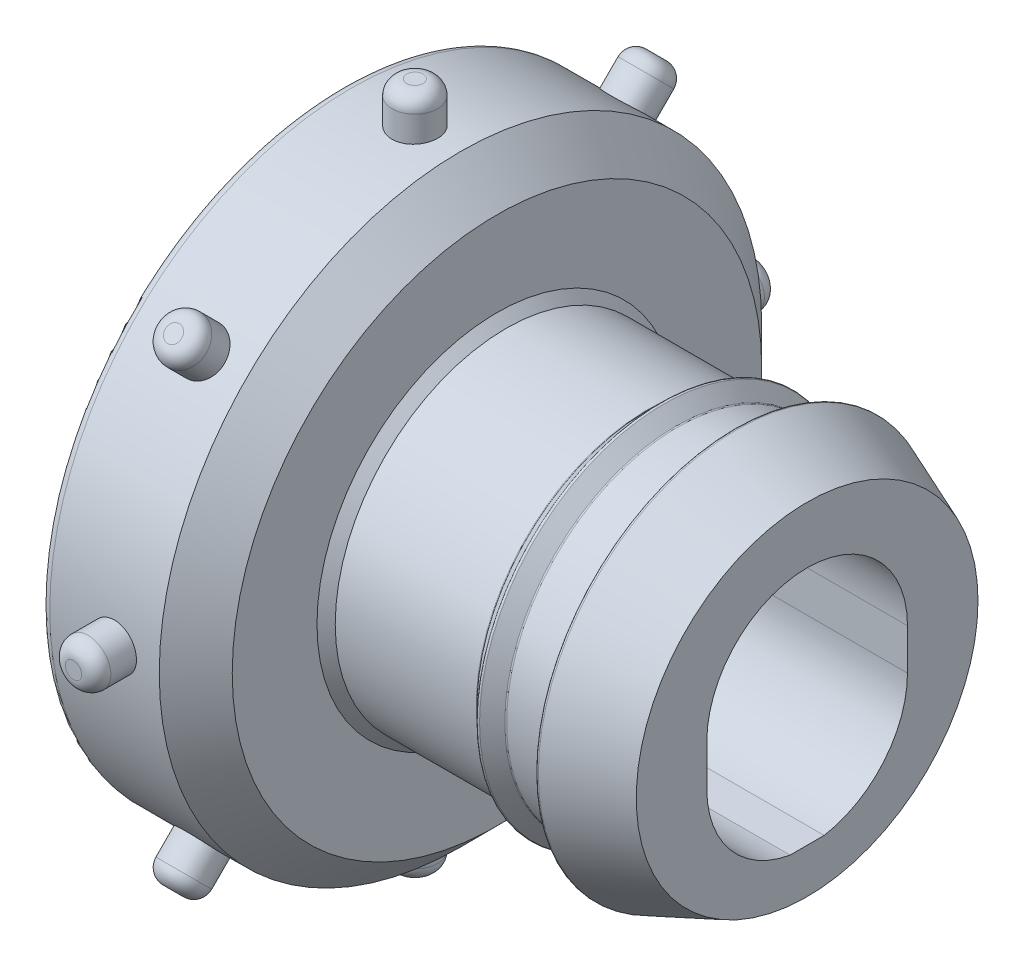
from build123d import *

# Parameters (mm, degrees)
SKETCH2_R                = 16.51
SKETCH2_R_2              = 9.365
SKETCH2_R_3              = 6.5
BOSS_EXTRUDE1_DEPTH      = 8.5
SKETCH4_W                = 18.18
SKETCH4_H                = 13.55
CUT_EXTRUDE1_DEPTH       = 7
SKETCH6_R                = 0.9
FILLET1_R                = 1
BOSS_EXTRUDE2_START      = -2
SKETCH7_R                = 1.25
BOSS_EXTRUDE2_DEPTH      = 4.2
FILLET2_R                = 0.8
CIRPATTERN1_COUNT        = 8
FILLET2_OF_CIRPATTERN1_R = 0.8
CHAMFER1_SIZE            = 2
FILLET3_R                = 0.5
FILLET4_R                = 0.1
CHAMFER2_SIZE            = 0.5
CUT_EXTRUDE2_DEPTH       = 32.450408582
CUT_EXTRUDE2_DEPTH_BACK  = 32.450408582
SKETCH2_3_R              = 6.5
CHAMFER3_SIZE            = 1
CHAMFER3_SIZE2           = 4.010780934
SKETCH8_W                = 2.59
SKETCH8_H                = 7.65
BOSS_EXTRUDE3_DEPTH      = 0.64
FILLET5_R                = 0.5
SKETCH9_R                = 9.365
BOSS_EXTRUDE4_DEPTH      = 18.5
CUT_EXTRUDE3_DEPTH       = 33.285882364
CHAMFER4_SIZE            = 3


with BuildPart() as part:
    # Sketch1 → Revolve1 (revolve)
    with BuildSketch(Plane(origin=(0, 0, 0), x_dir=(1, 0, 0), z_dir=(0, 1, 0))):
        Polygon((0, 0), (-17, 0), (-17, 9.365), (-8.73, 9.365), (-7.94, 10.155), (-7.15, 9.365), (-3.97, 9.365), (-3.97, 10.955), (0, 9.365), align=None)
    revolve(axis=Axis((0, 0, 0), (-1, 0, 0)))

    # Sketch2 → Boss-Extrude1 (add)
    # profile 1 of 2: a face of its own
    with BuildSketch(Plane.ZY.offset(17)):
        Circle(SKETCH2_R)
        with Locations(Location((0, 0, 0), (0, 0, 180))):
            Circle(SKETCH2_R_2, mode=Mode.SUBTRACT)
    # profile 2 of 2: a face of its own
    with BuildSketch(Plane.ZY.offset(17)):
        with Locations(Location((0, 0, 0), (0, 0, 180))):
            Circle(SKETCH2_R_2)
        Circle(SKETCH2_R_3, mode=Mode.SUBTRACT)
    extrude(amount=BOSS_EXTRUDE1_DEPTH)

    # Sketch4 → Cut-Extrude1 (cut)
    with BuildSketch(Plane.ZY.offset(25.5)):
        with Locations((0, -0.145)):
            Rectangle(SKETCH4_W, SKETCH4_H)
    extrude(amount=-CUT_EXTRUDE1_DEPTH, mode=Mode.SUBTRACT)

    # Sketch6 → Cut-Revolve1 (revolve, cut)
    with BuildSketch(Plane.XY, mode=Mode.PRIVATE) as cut_revolve1_sk:
        with Locations((-25.5, 14.14)):
            Circle(SKETCH6_R)
    revolve(cut_revolve1_sk.sketch.rotate(Axis((-35.027065124, 0, 0), (1, 0, 0)), 90), axis=Axis((-35.027065124, 0, 0), (1, 0, 0)), mode=Mode.SUBTRACT)

    # Fillet1
    fillet1_edges = [part.edges().sort_by_distance(p)[0] for p in [
        (-25.5, 0, -13.24),
    ]]
    fillet(fillet1_edges, radius=FILLET1_R)

    # Sketch7 → Boss-Extrude2 (add)
    with BuildSketch(Plane(origin=(0, 16.51, 0), x_dir=(1, 0, 0), z_dir=(0, 1, 0)).offset(BOSS_EXTRUDE2_START)):
        with Locations(Location((-21.5, 0, 0), (0, 0, 270))):
            Circle(SKETCH7_R)
    boss_extrude2 = extrude(amount=BOSS_EXTRUDE2_DEPTH)

    # Fillet2
    fillet2_edges = [part.edges().sort_by_distance(p)[0] for p in [
        (-21.5, 18.71, -1.25),
    ]]
    fillet(fillet2_edges, radius=FILLET2_R)

    # CirPattern1: Boss-Extrude2 ×8 about axis
    cirpattern1_axis = Axis((0, 0, 0), (1, 0, 0))
    for i in range(1, CIRPATTERN1_COUNT):
        add(boss_extrude2.rotate(cirpattern1_axis, i * 360 / CIRPATTERN1_COUNT))

    # Fillet2 of CirPattern1
    fillet2_of_cirpattern1_edges = [part.edges().sort_by_distance(p)[0] for p in [
        (-21.5, 14.113851352, 12.3460844),
        (-21.5, 1.25, 18.71),
        (-21.5, -12.3460844, 14.113851352),
        (-21.5, -18.71, 1.25),
        (-21.5, -14.113851352, -12.3460844),
        (-21.5, -1.25, -18.71),
        (-21.5, 12.3460844, -14.113851352),
    ]]
    fillet(fillet2_of_cirpattern1_edges, radius=FILLET2_OF_CIRPATTERN1_R)

    # Chamfer1
    chamfer1_edges = [part.edges().sort_by_distance(p)[0] for p in [
        (-17, 0, -16.51),
    ]]
    chamfer(chamfer1_edges, length=CHAMFER1_SIZE)

    # Fillet3
    fillet3_edges = [part.edges().sort_by_distance(p)[0] for p in [
        (-25.5, 0, -16.51),
    ]]
    fillet(fillet3_edges, radius=FILLET3_R)

    # Fillet4
    fillet4_edges = [part.edges().sort_by_distance(p)[0] for p in [
        (-3.97, 0, 9.365),
        (-3.97, 0, 10.955),
        (-8.73, 0, 9.365),
        (-7.94, 0, 10.155),
        (-7.15, 0, 9.365),
    ]]
    fillet(fillet4_edges, radius=FILLET4_R)

    # Chamfer2
    chamfer2_edges = [part.edges().sort_by_distance(p)[0] for p in [
        (-17, 0, 9.365),
    ]]
    chamfer(chamfer2_edges, length=CHAMFER2_SIZE)

    # Sketch2<3> → Cut-Extrude2 (cut, two sides: drawn at the far end of the back side and taken through both)
    with BuildSketch(Plane.ZY.offset(17).offset(-CUT_EXTRUDE2_DEPTH_BACK)):
        with Locations(Location((0, 0, 0), (0, 0, 180))):
            Circle(SKETCH2_3_R)
    extrude(amount=CUT_EXTRUDE2_DEPTH + CUT_EXTRUDE2_DEPTH_BACK, mode=Mode.SUBTRACT)

    # Chamfer3
    chamfer3_edges = [part.edges().sort_by_distance(p)[0] for p in [
        (-25.5, -6.92, 0),
    ]]
    chamfer3_side = [part.faces().sort_by_distance(p)[0] for p in [
        (-25.5, 0, -12.170205593),
    ]]
    chamfer(chamfer3_edges, length=CHAMFER3_SIZE, length2=CHAMFER3_SIZE2, reference=chamfer3_side[0])

    # Sketch8 → Boss-Extrude3 (add)
    with BuildSketch(Plane.ZY.offset(18.5)):
        with Locations((-7.795, -3.095)):
            Rectangle(SKETCH8_W, SKETCH8_H)
    extrude(amount=BOSS_EXTRUDE3_DEPTH)

    # Fillet5
    fillet5_edges = [part.edges().sort_by_distance(p)[0] for p in [
        (-19.14, -3.095, -6.5),
        (-19.14, 0.73, -7.795),
    ]]
    fillet(fillet5_edges, radius=FILLET5_R)

    # Sketch9 → Boss-Extrude4 (add)
    with BuildSketch(Plane(origin=(0, 0, 0), x_dir=(0, 0, -1), z_dir=(1, 0, 0))):
        Circle(SKETCH9_R)
    extrude(amount=-BOSS_EXTRUDE4_DEPTH)

    # Sketch10 → Cut-Extrude3 (cut, through all)
    with BuildSketch(Plane.ZY.offset(18.5)):
        with BuildLine():
            ThreePointArc((-5.383713867, -0.375), (-0.193085417, 3.996609684), (5.291502622, 0))
            Line((5.291502622, 0), (5.448623679, 0))
            ThreePointArc((5.448623679, 0), (5.487140887, 0.374121188), (5.5, 0.75))
            ThreePointArc((5.5, 0.75), (0, 6.25), (-5.5, 0.75))
            ThreePointArc((-5.5, 0.75), (-5.470851226, 0.184502992), (-5.383713867, -0.375))
        make_face()
        with BuildLine():
            Line((5.448623679, 0), (5.291502622, 0))
            ThreePointArc((5.291502622, 0), (5.340900488, -0.186690448), (5.383713867, -0.375))
            ThreePointArc((5.383713867, -0.375), (5.419413292, -0.188061603), (5.448623679, 0))
        make_face()
        with BuildLine():
            ThreePointArc((5.383713867, -0.375), (5.340900488, -0.186690448), (5.291502622, 0))
            ThreePointArc((5.291502622, 0), (-0.193085417, 3.996609684), (-5.383713867, -0.375))
            ThreePointArc((-5.383713867, -0.375), (0, -4.75), (5.383713867, -0.375))
        make_face()
        with BuildLine():
            ThreePointArc((5.5, -1.5), (5.470851226, -0.934502992), (5.383713867, -0.375))
            ThreePointArc((5.383713867, -0.375), (0, -4.75), (-5.383713867, -0.375))
            ThreePointArc((-5.383713867, -0.375), (-5.470851226, -0.934502992), (-5.5, -1.5))
            ThreePointArc((-5.5, -1.5), (-4.206581833, -5.043256875), (-0.934665716, -6.92))
            Line((-0.934665716, -6.92), (0.934665716, -6.92))
            ThreePointArc((0.934665716, -6.92), (4.206581833, -5.043256875), (5.5, -1.5))
        make_face()
        with BuildLine():
            Line((5.5, 0), (5.448623679, 0))
            ThreePointArc((5.448623679, 0), (5.419413292, -0.188061603), (5.383713867, -0.375))
            ThreePointArc((5.383713867, -0.375), (5.470851226, -0.934502992), (5.5, -1.5))
            Line((5.5, -1.5), (5.5, 0))
        make_face()
        with BuildLine():
            ThreePointArc((5.5, 0.75), (5.487140887, 0.374121188), (5.448623679, 0))
            Line((5.448623679, 0), (5.5, 0))
            Line((5.5, 0), (5.5, 0.75))
        make_face()
        with BuildLine():
            ThreePointArc((-5.5, -1.5), (-5.470851226, -0.934502992), (-5.383713867, -0.375))
            ThreePointArc((-5.383713867, -0.375), (-5.470851226, 0.184502992), (-5.5, 0.75))
            Line((-5.5, 0.75), (-5.5, -1.5))
        make_face()
    extrude(amount=-CUT_EXTRUDE3_DEPTH, mode=Mode.SUBTRACT)

    # Chamfer4
    # the kernel refuses this chamfer: 3 mm, written as the material it takes off along each edge
    with BuildSketch(Plane(origin=(-18.5, -1.5, 0), x_dir=(0, -0.331959900839862, 0.9432934984586657), z_dir=(0, 0.9432934984586657, 0.331959900839862))) as chamfer4_piece_1_section:
        Polygon((5.5 + CHAMFER4_SIZE, 0), (5.5, CHAMFER4_SIZE), (5.5, 0), align=None)
    chamfer4_piece_1 = revolve(axis=Axis((-18.5, -1.5, 0), (1, 0, 0)), revolution_arc=160.612223261, mode=Mode.PRIVATE)
    chamfer4_piece_1 = split(chamfer4_piece_1, bisect_by=Plane(origin=(-17.447070523, -5.452656948, -6.5), z_dir=(0, 0, 1)), keep=Keep.TOP, mode=Mode.PRIVATE)
    chamfer4_piece_1 = split(chamfer4_piece_1, bisect_by=Plane(origin=(-17.447070523, -6.92, 4.818402708), z_dir=(0, 1, 0)), keep=Keep.TOP, mode=Mode.PRIVATE)
    add(chamfer4_piece_1, mode=Mode.SUBTRACT)
    with BuildSketch(Plane(origin=(-18.5, 0.75, 0), x_dir=(0, 0, 1), z_dir=(0, -1, 0))) as chamfer4_piece_2_section:
        Polygon((5.5 + CHAMFER4_SIZE, 0), (5.5, -CHAMFER4_SIZE), (5.5, 0), align=None)
    chamfer4_piece_2 = revolve(axis=Axis((-18.5, 0.75, 0), (-1, 0, 0)), revolution_arc=180, mode=Mode.PRIVATE)
    chamfer4_piece_2 = split(chamfer4_piece_2, bisect_by=Plane(origin=(-17.662102139, 6.63, 6.378806092), z_dir=(0, -1, 0)), keep=Keep.TOP, mode=Mode.PRIVATE)
    add(chamfer4_piece_2, mode=Mode.SUBTRACT)
    with BuildSketch(Plane(origin=(-18.5, -1.5, 0), x_dir=(0, 0, 1), z_dir=(0, 1, 0))) as chamfer4_piece_3_section:
        Polygon((5.5 + CHAMFER4_SIZE, 0), (5.5, CHAMFER4_SIZE), (5.5, 0), align=None)
    chamfer4_piece_3 = revolve(axis=Axis((-18.5, -1.5, 0), (1, 0, 0)), revolution_arc=160.612223261, mode=Mode.PRIVATE)
    chamfer4_piece_3 = split(chamfer4_piece_3, bisect_by=Plane(origin=(-17.657091306, -3.490113714, -6.5), z_dir=(0, 0, 1)), keep=Keep.TOP, mode=Mode.PRIVATE)
    chamfer4_piece_3 = split(chamfer4_piece_3, bisect_by=Plane(origin=(-17.657091306, -6.92, 6.383499273), z_dir=(0, 1, 0)), keep=Keep.TOP, mode=Mode.PRIVATE)
    add(chamfer4_piece_3, mode=Mode.SUBTRACT)
    with BuildSketch(Plane(origin=(-18.5, 0.75, -5.5), x_dir=(-0.027495876610586806, 0, -0.9996219169112968), z_dir=(0, -1, 0))) as chamfer4_piece_4_section:
        Polygon((CHAMFER4_SIZE * 0.999621916911, CHAMFER4_SIZE * 0.0274958766106), (-CHAMFER4_SIZE * 0.0274958766106, CHAMFER4_SIZE * 0.999621916911), (0, 0), align=None)
    chamfer4_piece_4 = extrude(amount=2.25, mode=Mode.PRIVATE)
    chamfer4_piece_4 = split(chamfer4_piece_4, bisect_by=Plane(origin=(-17.833333333, 0.73, -7.166666667), z_dir=(0, 1, 0)), keep=Keep.TOP, mode=Mode.PRIVATE)
    add(chamfer4_piece_4, mode=Mode.SUBTRACT)
    with BuildSketch(Plane(origin=(-18.5, 0.75, -5.5), x_dir=(-0.027495876610586806, 0, -0.9996219169112968), z_dir=(0, -1, 0))) as chamfer4_piece_5_section:
        Polygon((CHAMFER4_SIZE * 0.999621916911, CHAMFER4_SIZE * 0.0274958766106), (-CHAMFER4_SIZE * 0.0274958766106, CHAMFER4_SIZE * 0.999621916911), (0, 0), align=None)
    chamfer4_piece_5 = extrude(amount=2.25, mode=Mode.PRIVATE)
    chamfer4_piece_5 = split(chamfer4_piece_5, bisect_by=Plane(origin=(-17.233333333, -0.385, -6.5), z_dir=(0, 0, 1)), keep=Keep.TOP, mode=Mode.PRIVATE)
    add(chamfer4_piece_5, mode=Mode.SUBTRACT)
    with BuildSketch(Plane(origin=(-18.5, 0.75, 5.5), x_dir=(-0.027495876610586757, 0, 0.9996219169112968), z_dir=(0, -1, 0))) as chamfer4_piece_6:
        Polygon((CHAMFER4_SIZE * 0.999621916911, -CHAMFER4_SIZE * 0.0274958766106), (-CHAMFER4_SIZE * 0.0274958766106, -CHAMFER4_SIZE * 0.999621916911), (0, 0), align=None)
    extrude(amount=2.25, mode=Mode.SUBTRACT)


solid = part.part
